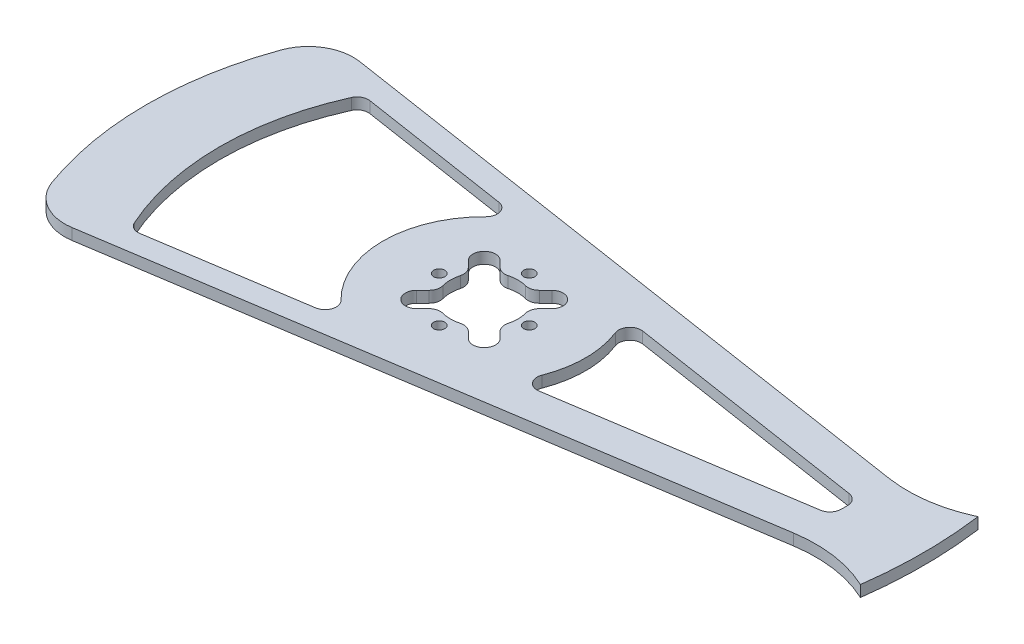
from build123d import *

# Parameters (mm, degrees)
BOSS_EXTRUDE1_DEPTH = 6.35
FILLET1_R           = 6.35
FILLET2_R           = 25.4
FILLET3_R           = 6.35
SKETCH2_R           = 3.175
CUT_EXTRUDE1_DEPTH  = 261.770480457


with BuildPart() as part:
    # Sketch1 → Boss-Extrude1 (new body)
    with BuildSketch(Plane(origin=(0, 0, 0), x_dir=(1, 0, 0), z_dir=(0, 1, 0))):
        with BuildLine():
            Line((201.422109564, 26.821144246), (-170.916556976, 84.129546246))
            ThreePointArc((-170.916556976, 84.129546246), (-190.5, 0), (-170.916556976, -84.129546246))
            Line((-170.916556976, -84.129546246), (201.422109564, -26.821144246))
            ThreePointArc((201.422109564, -26.821144246), (223.893573766, -26.714977166), (245.418848947, -33.167922475))
            ThreePointArc((245.418848947, -33.167922475), (247.65, 0), (245.418848947, 33.167922475))
            ThreePointArc((245.418848947, 33.167922475), (223.893573766, 26.714977166), (201.422109564, 26.821144246))
        make_face()
        with BuildLine():
            ThreePointArc((-134.096982275, -65.612922331), (-149.2885, 0), (-134.096982275, 65.612922331))
            Line((-134.096982275, 65.612922331), (-28.741073501, 49.39709702))
            ThreePointArc((-28.741073501, 49.39709702), (-57.15, 0), (-28.741073501, -49.39709702))
            Line((-28.741073501, -49.39709702), (-134.096982275, -65.612922331))
        make_face(mode=Mode.SUBTRACT)
        with BuildLine():
            Line((-17.190128061, 8.209871939), (-23.540128061, 14.559871939))
            ThreePointArc((-23.540128061, 14.559871939), (-23.540128061, 23.540128061), (-14.559871939, 23.540128061))
            Line((-14.559871939, 23.540128061), (-8.209871939, 17.190128061))
            ThreePointArc((-8.209871939, 17.190128061), (0, 19.05), (8.209871939, 17.190128061))
            Line((8.209871939, 17.190128061), (14.559871939, 23.540128061))
            ThreePointArc((14.559871939, 23.540128061), (21.480039796, 24.916635031), (25.4, 19.05))
            ThreePointArc((25.4, 19.05), (24.916635031, 16.619960204), (23.540128061, 14.559871939))
            Line((23.540128061, 14.559871939), (17.190128061, 8.209871939))
            ThreePointArc((17.190128061, 8.209871939), (18.579214724, 4.20895239), (19.05, 0))
            ThreePointArc((19.05, 0), (18.579214724, -4.20895239), (17.190128061, -8.209871939))
            Line((17.190128061, -8.209871939), (23.540128061, -14.559871939))
            ThreePointArc((23.540128061, -14.559871939), (24.916635031, -16.619960204), (25.4, -19.05))
            ThreePointArc((25.4, -19.05), (21.480039796, -24.916635031), (14.559871939, -23.540128061))
            Line((14.559871939, -23.540128061), (8.209871939, -17.190128061))
            ThreePointArc((8.209871939, -17.190128061), (0, -19.05), (-8.209871939, -17.190128061))
            Line((-8.209871939, -17.190128061), (-14.559871939, -23.540128061))
            ThreePointArc((-14.559871939, -23.540128061), (-23.540128061, -23.540128061), (-23.540128061, -14.559871939))
            Line((-23.540128061, -14.559871939), (-17.190128061, -8.209871939))
            ThreePointArc((-17.190128061, -8.209871939), (-19.05, 0), (-17.190128061, 8.209871939))
        make_face(mode=Mode.SUBTRACT)
        with BuildLine():
            ThreePointArc((47.897230141, -31.17655922), (57.15, 0), (47.897230141, 31.17655922))
            Line((47.897230141, 31.17655922), (203.069070408, 7.293328709))
            ThreePointArc((203.069070408, 7.293328709), (203.2, 0), (203.069070408, -7.293328709))
            Line((203.069070408, -7.293328709), (47.897230141, -31.17655922))
        make_face(mode=Mode.SUBTRACT)
    extrude(amount=BOSS_EXTRUDE1_DEPTH)

    # Fillet1
    fillet1_edges = [part.edges().sort_by_distance(p)[0] for p in [
        (47.897230141, 3.175, 31.17655922),
        (47.897230141, 3.175, -31.17655922),
        (203.069070408, 3.175, -7.293328709),
        (203.069070408, 3.175, 7.293328709),
        (-134.096982275, 3.175, -65.612922331),
        (-134.096982275, 3.175, 65.612922331),
        (-28.741073501, 3.175, -49.39709702),
        (-28.741073501, 3.175, 49.39709702),
    ]]
    fillet(fillet1_edges, radius=FILLET1_R)

    # Fillet2
    fillet2_edges = [part.edges().sort_by_distance(p)[0] for p in [
        (-170.916556976, 3.175, -84.129546246),
        (-170.916556976, 3.175, 84.129546246),
    ]]
    fillet(fillet2_edges, radius=FILLET2_R)

    # Fillet3
    fillet3_edges = [part.edges().sort_by_distance(p)[0] for p in [
        (-8.209871939, 3.175, 17.190128061),
        (8.209871939, 3.175, 17.190128061),
        (17.190128061, 3.175, 8.209871939),
        (17.190128061, 3.175, -8.209871939),
        (-8.209871939, 3.175, -17.190128061),
        (8.209871939, 3.175, -17.190128061),
        (-17.190128061, 3.175, -8.209871939),
        (-17.190128061, 3.175, 8.209871939),
    ]]
    fillet(fillet3_edges, radius=FILLET3_R)

    # Sketch2 → Cut-Extrude1 (cut, through all)
    with BuildSketch(Plane(origin=(0, 6.35, 0), x_dir=(1, 0, 0), z_dir=(0, 1, 0))):
        with Locations((0, 25.4)):
            Circle(SKETCH2_R)
        with Locations((25.4, 0)):
            Circle(SKETCH2_R)
        with Locations((0, -25.4)):
            Circle(SKETCH2_R)
        with Locations((-25.4, 0)):
            Circle(SKETCH2_R)
    extrude(amount=-CUT_EXTRUDE1_DEPTH, mode=Mode.SUBTRACT)


solid = part.part
